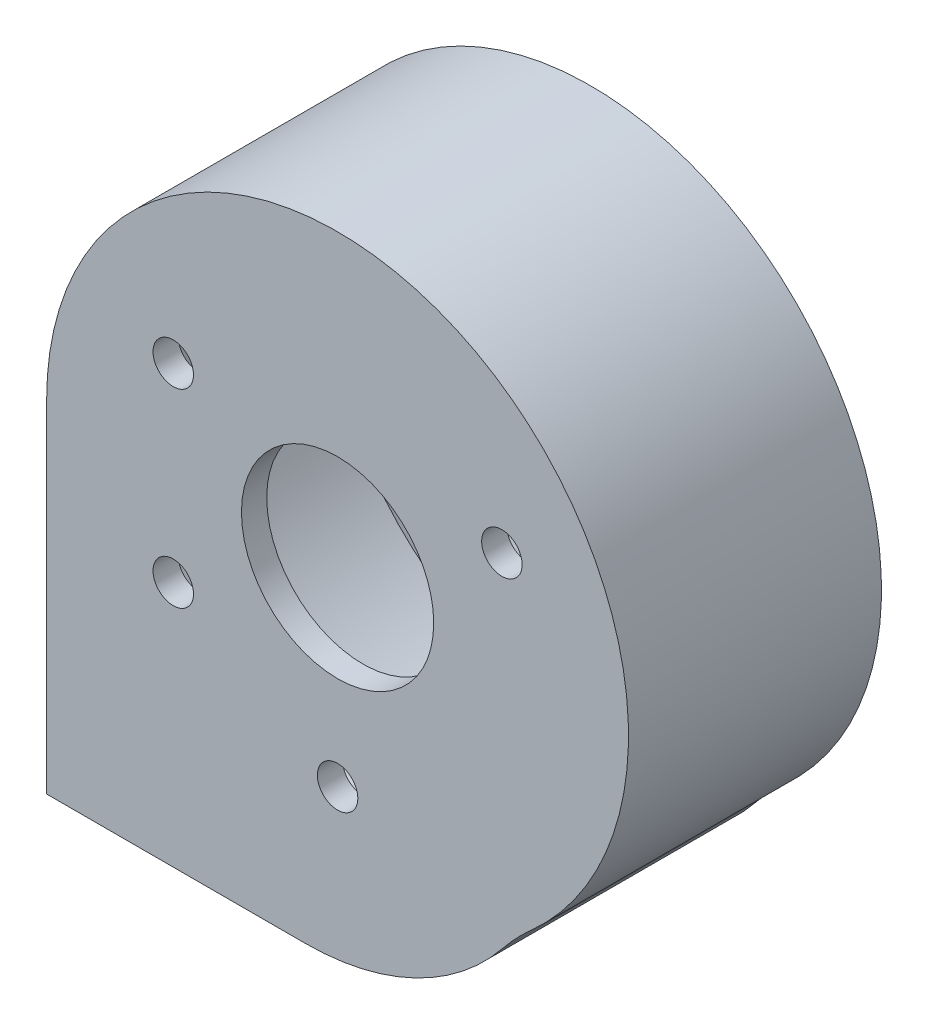
from build123d import *

# Parameters (mm, degrees)
SKETCH_1_R           = 1.6
SKETCH_1_R_2         = 7.6
EXTRUDE_1_DEPTH      = 20
SKETCH_3_R           = 21.1
CUT_EXTRUDE_11_DEPTH = 18
EXTRUDE_2_DEPTH      = 20
FILLET_3_R           = 3
SKETCH_5_R           = 1.5
CUT_EXTRUDE_12_DEPTH = 5


with BuildPart() as part:
    # 草图1 → 凸台-拉伸1 (new body)
    with BuildSketch(Plane.XY):
        with BuildLine():
            Line((-23, 0), (-23, -27))
            Line((-23, -27), (-2.527032193, -27))
            ThreePointArc((-2.527032193, -27), (6.11037495, -25.038713863), (13.053739404, -19.539519785))
            ThreePointArc((13.053739404, -19.539519785), (14.135978403, -18.302517785), (15.316133792, -17.158556049))
            ThreePointArc((15.316133792, -17.158556049), (9.400237305, 20.991320554), (-23, 0))
        make_face()
        with Locations((12.990381057, 7.5)):
            Circle(SKETCH_1_R, mode=Mode.SUBTRACT)
        with Locations((0, -15)):
            Circle(SKETCH_1_R, mode=Mode.SUBTRACT)
        with Locations((-12.990381057, -7.5)):
            Circle(SKETCH_1_R, mode=Mode.SUBTRACT)
        with Locations((-12.990381057, 7.5)):
            Circle(SKETCH_1_R, mode=Mode.SUBTRACT)
        Circle(SKETCH_1_R_2, mode=Mode.SUBTRACT)
    extrude(amount=EXTRUDE_1_DEPTH)

    # 草图3 → 切除-拉伸11 (cut)
    with BuildSketch(Plane(origin=(0, 0, 0), x_dir=(-1, 0, 0), z_dir=(0, 0, -1))):
        Circle(SKETCH_3_R)
    extrude(amount=-CUT_EXTRUDE_11_DEPTH, mode=Mode.SUBTRACT)

    # 草图4 → 凸台-拉伸2 (add)
    with BuildSketch(Plane(origin=(0, 0, 0), x_dir=(-1, 0, 0), z_dir=(0, 0, -1))):
        with BuildLine():
            Line((2.527032193, -24), (2.527032193, -27))
            Line((2.527032193, -27), (23, -27))
            Line((23, -27), (23, -24))
            Line((23, -24), (23, -14.78470732))
            Line((23, -14.78470732), (19.073497874, -14.78470732))
            ThreePointArc((19.073497874, -14.78470732), (11.742066666, -21.083400155), (2.527032193, -24))
        make_face()
    extrude(amount=EXTRUDE_2_DEPTH)

    # 圆角3
    fillet_3_edges = [part.edges().sort_by_distance(p)[0] for p in [
        (-2.527032193, -25.5, 0),
        (-21.036748937, -14.78470732, 0),
        (-11.742066666, -21.083400155, 0),
    ]]
    fillet(fillet_3_edges, radius=FILLET_3_R)

    # 草图5 → 切除-拉伸12 (cut)
    with BuildSketch(Plane.XZ.offset(27)):
        with Locations((-18, 15)):
            Circle(SKETCH_5_R)
        with Locations((-6.527032193, 15)):
            Circle(SKETCH_5_R)
        with Locations((-6.527032193, -15)):
            Circle(SKETCH_5_R)
        with Locations((-18, -15)):
            Circle(SKETCH_5_R)
    extrude(amount=-CUT_EXTRUDE_12_DEPTH, mode=Mode.SUBTRACT)


solid = part.part
